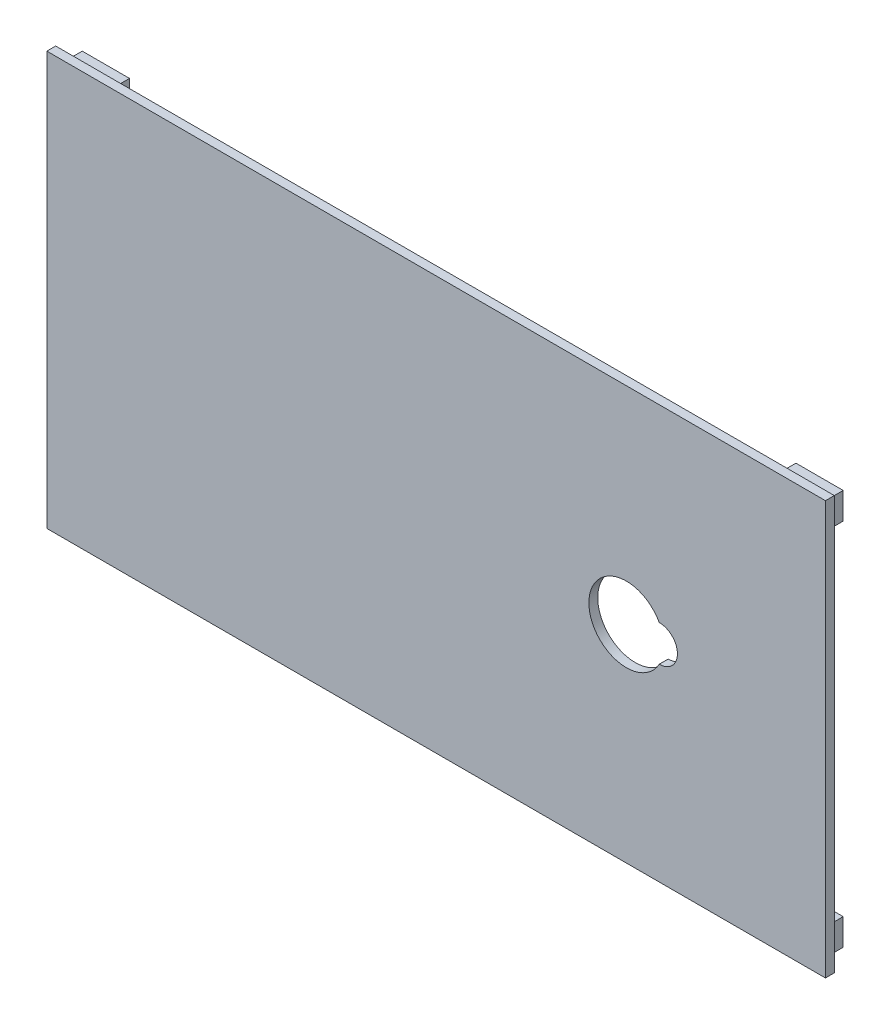
from build123d import *

# Parameters (mm, degrees)
SKETCH1_W                 = 131.85
SKETCH1_H                 = 70
BOSS_EXTRUDE1_DEPTH       = 1.5
CUT_EXTRUDE1_REACH        = 137.268
SKETCH4_W                 = 8
SKETCH4_H                 = 4.5
SKETCH4_W_2               = 5
SKETCH4_H_2               = 1.5
BOSS_EXTRUDE2_DEPTH       = 3
MIRROR2_COPY_1_SKETCH_W   = 8
MIRROR2_COPY_1_SKETCH_H   = 4.5
MIRROR2_COPY_1_SKETCH_W_2 = 5
MIRROR2_COPY_1_SKETCH_H_2 = 1.5
MIRROR2_COPY_1_DEPTH      = 3


with BuildPart() as part:
    # Sketch1 → Boss-Extrude1 (new body)
    with BuildSketch(Plane.XY):
        with Locations((55.175, 25.25)):
            Rectangle(SKETCH1_W, SKETCH1_H)
    extrude(amount=BOSS_EXTRUDE1_DEPTH)

    # Sketch2 → Cut-Extrude1 (cut, up to next)
    with BuildSketch(Plane.XY.offset(1.5), mode=Mode.PRIVATE) as cut_extrude1_sk1:
        with BuildLine():
            Line((92.957060126, 22.2), (92.9875, 22.2))
            ThreePointArc((92.9875, 22.2), (96.0375, 25.25), (92.9875, 28.3))
            Line((92.9875, 28.3), (92.957060126, 28.3))
            ThreePointArc((92.957060126, 28.3), (81.0375, 25.25), (92.957060126, 22.2))
        make_face()
    cut_extrude1_tool1 = extrude(cut_extrude1_sk1.sketch, amount=-CUT_EXTRUDE1_REACH, mode=Mode.PRIVATE) & part.part
    add(cut_extrude1_tool1.solids().sort_by_distance((87.98685, 25.25, 1.5))[0], mode=Mode.SUBTRACT)

    # Sketch4 → Boss-Extrude2 (add)
    with BuildSketch(Plane(origin=(0, 0, 0), x_dir=(-1, 0, 0), z_dir=(0, 0, -1))):
        with Locations((-115.6, 56.5)):
            Rectangle(SKETCH4_W, SKETCH4_H)
        with Locations((-115.6, 56.5)):
            Rectangle(SKETCH4_W_2, SKETCH4_H_2, mode=Mode.SUBTRACT)
    boss_extrude2 = extrude(amount=BOSS_EXTRUDE2_DEPTH)

    # Mirror1: Boss-Extrude2 across plane
    add(boss_extrude2.mirror(Plane.ZX.offset(25.25)))

    # Mirror2: Boss-Extrude2 across plane
    add(boss_extrude2.mirror(Plane(origin=(55.175, 0, 0), x_dir=(0, 0, 1), z_dir=(1, 0, 0))))

    # Mirror2 copy 1 sketch → Mirror2 copy 1 (add)
    with BuildSketch(Plane(origin=(110.35, 50.5, 0), x_dir=(1, 0, 0), z_dir=(0, 0, -1))):
        with Locations((-115.6, 56.5)):
            Rectangle(MIRROR2_COPY_1_SKETCH_W, MIRROR2_COPY_1_SKETCH_H)
        with Locations((-115.6, 56.5)):
            Rectangle(MIRROR2_COPY_1_SKETCH_W_2, MIRROR2_COPY_1_SKETCH_H_2, mode=Mode.SUBTRACT)
    extrude(amount=MIRROR2_COPY_1_DEPTH)


solid = part.part
